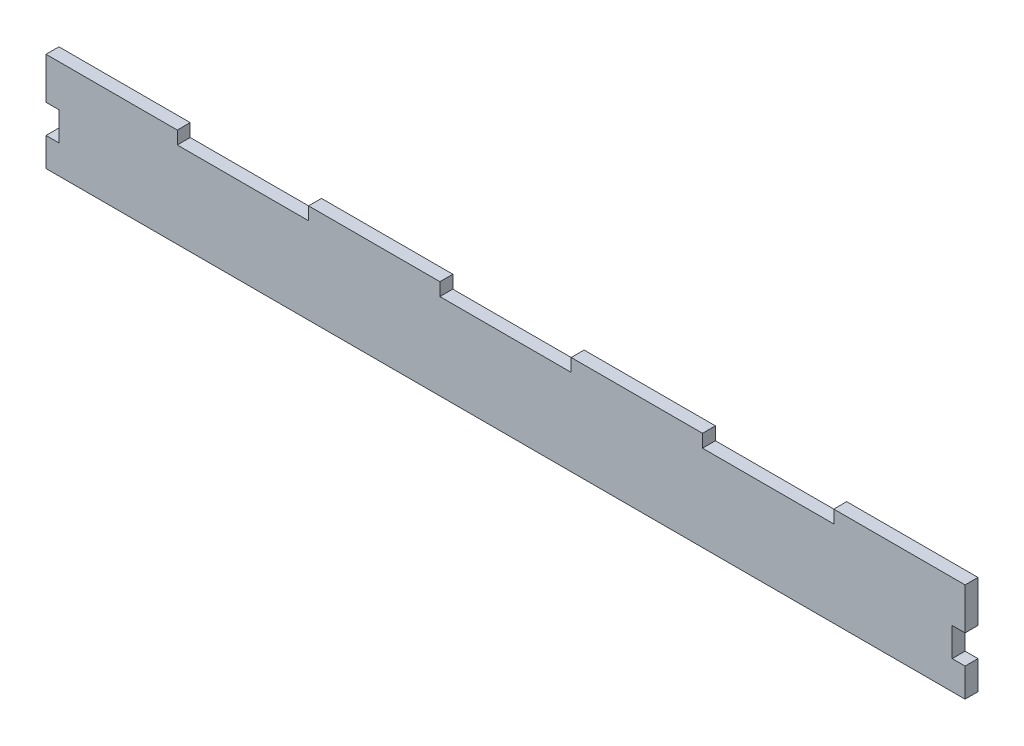
from build123d import *

# Parameters (mm, degrees)
SKETCH1_W               = 415
SKETCH1_H               = 126.5
BOSS_EXTRUDE1_DEPTH     = 6
SKETCH2_W               = 427
SKETCH2_H               = 6
BOSS_EXTRUDE2_DEPTH     = 40
CUT_EXTRUDE1_DEPTH      = 228.010599973
CUT_EXTRUDE1_DEPTH_BACK = 228.010599973
SKETCH1_2_W             = 415
SKETCH1_2_H             = 126.5
SKETCH2_4_W             = 61
SKETCH2_4_H             = 6
BOSS_EXTRUDE3_DEPTH     = 6
SKETCH3_W               = 6
SKETCH3_H               = 13.333333334
CUT_EXTRUDE2_DEPTH      = 6


with BuildPart() as part:
    # Sketch1 → Boss-Extrude1 (new body)
    with BuildSketch(Plane(origin=(0, 0, 0), x_dir=(1, 0, 0), z_dir=(0, 1, 0))):
        Rectangle(SKETCH1_W, SKETCH1_H)
    extrude(amount=BOSS_EXTRUDE1_DEPTH)

    # Sketch2 → Boss-Extrude2 (add)
    with BuildSketch(Plane(origin=(0, 6, 0), x_dir=(1, 0, 0), z_dir=(0, 1, 0))):
        with Locations((0, 66.25)):
            Rectangle(SKETCH2_W, SKETCH2_H)
    extrude(amount=-BOSS_EXTRUDE2_DEPTH)

    # Sketch1<2> → Cut-Extrude1 (cut, two sides: drawn at the far end of the back side and taken through both)
    with BuildSketch(Plane(origin=(0, 0, 0), x_dir=(1, 0, 0), z_dir=(0, 1, 0)).offset(-CUT_EXTRUDE1_DEPTH_BACK)):
        Rectangle(SKETCH1_2_W, SKETCH1_2_H)
    extrude(amount=CUT_EXTRUDE1_DEPTH + CUT_EXTRUDE1_DEPTH_BACK, mode=Mode.SUBTRACT)

    # Sketch2<4> → Boss-Extrude3 (add)
    with BuildSketch(Plane(origin=(0, 6, 0), x_dir=(1, 0, 0), z_dir=(0, 1, 0))):
        with Locations((183, 66.25)):
            Rectangle(SKETCH2_4_W, SKETCH2_4_H)
        with Locations((61, 66.25)):
            Rectangle(SKETCH2_4_W, SKETCH2_4_H)
        with Locations((-61, 66.25)):
            Rectangle(SKETCH2_4_W, SKETCH2_4_H)
        with Locations((-183, 66.25)):
            Rectangle(SKETCH2_4_W, SKETCH2_4_H)
    extrude(amount=BOSS_EXTRUDE3_DEPTH)

    # Sketch3 → Cut-Extrude2 (cut)
    with BuildSketch(Plane.XY.offset(-63.25)):
        with Locations((-210.5, -14)):
            Rectangle(SKETCH3_W, SKETCH3_H)
    cut_extrude2 = extrude(amount=-CUT_EXTRUDE2_DEPTH, mode=Mode.SUBTRACT)

    # Mirror1: Cut-Extrude2 across plane
    add(cut_extrude2.mirror(Plane(origin=(0, 0, 0), x_dir=(0, 0, 1), z_dir=(1, 0, 0))), mode=Mode.SUBTRACT)


solid = part.part
